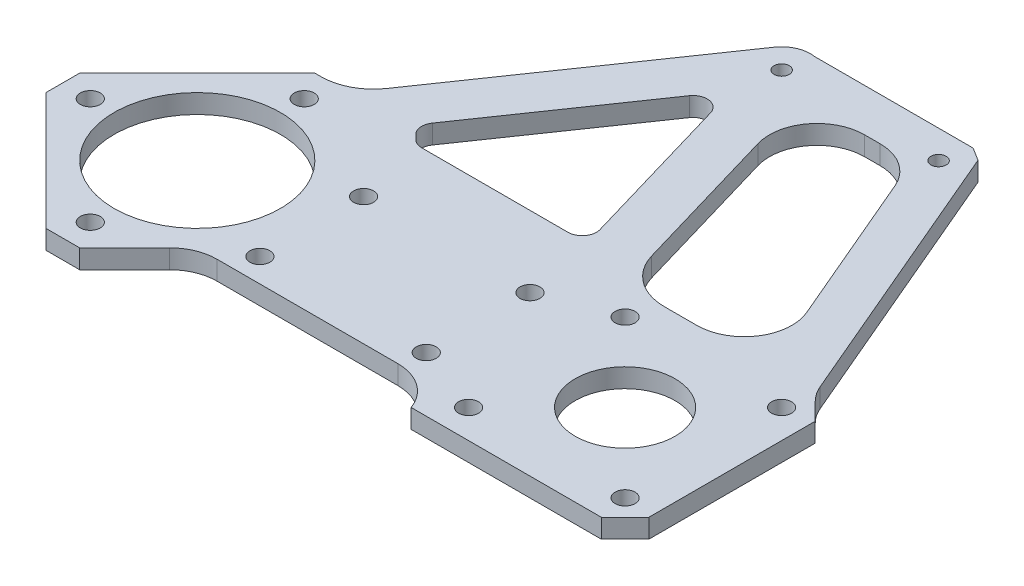
from build123d import *

# Parameters (mm, degrees)
SKETCH_1_R          = 2.1
SKETCH_1_R_2        = 10.5
SKETCH_1_R_3        = 10
EXTRUDE_1_DEPTH     = 4
CHAMFER_1_SIZE      = 5
FILLET_1_R          = 10
SKETCH_2_R          = 2.1
CUT_EXTRUDE_1_DEPTH = 10
EXTRUDE_START       = -4
SKETCH_3_R          = 1.6
EXTRUDE_2_DEPTH     = 4
FILLET_2_R          = 3
FILLET_3_R          = 11
SKETCH_4_R          = 1.6
EXTRUDE_3_DEPTH     = 4
FILLET_4_R          = 10
CHAMFER_2_SIZE      = 2
CHAMFER_2_SIZE2     = 1.851556395
FILLET_5_R          = 10
SKETCH_5_R          = 17.5
CUT_EXTRUDE_2_DEPTH = 10


with BuildPart() as part:
    # 草图1 → 凸台-拉伸1 (new body)
    with BuildSketch(Plane(origin=(0, 0, 0), x_dir=(1, 0, 0), z_dir=(0, 1, 0))):
        Polygon((0, 31.819805153), (-31.819805153, 0), (0, -31.819805153), (15.909902577, -15.909902577), (67.5, -15.909902577), (67.5, -22.5), (112.5, -22.5), (112.5, 22.5), (67.5, 22.5), (67.5, 15.909902577), (15.909902577, 15.909902577), align=None)
        with Locations(Location((0, 14, 0), (0, 0, 270))):
            Circle(SKETCH_1_R, mode=Mode.SUBTRACT)
        with Locations(Location((14, 0, 0), (0, 0, 270))):
            Circle(SKETCH_1_R, mode=Mode.SUBTRACT)
        with Locations(Location((0, -14, 0), (0, 0, 270))):
            Circle(SKETCH_1_R, mode=Mode.SUBTRACT)
        with Locations(Location((-14, 0, 0), (0, 0, 270))):
            Circle(SKETCH_1_R, mode=Mode.SUBTRACT)
        with Locations(Location((90, 0, 0), (0, 0, 270))):
            Circle(SKETCH_1_R_2, mode=Mode.SUBTRACT)
        with Locations(Location((0, 22.5, 0), (0, 0, 270))):
            Circle(SKETCH_1_R, mode=Mode.SUBTRACT)
        with Locations(Location((0, -22.5, 0), (0, 0, 270))):
            Circle(SKETCH_1_R, mode=Mode.SUBTRACT)
        with Locations(Location((0, 0, 0), (0, 0, 270))):
            Circle(SKETCH_1_R_3, mode=Mode.SUBTRACT)
        with Locations(Location((-22.5, 0, 0), (0, 0, 270))):
            Circle(SKETCH_1_R, mode=Mode.SUBTRACT)
    extrude(amount=EXTRUDE_1_DEPTH)

    # 倒角1
    chamfer_1_edges = [part.edges().sort_by_distance(p)[0] for p in [
        (112.5, 2, -22.5),
        (112.5, 2, 22.5),
        (0, 2, 31.819805153),
        (-31.819805153, 2, 0),
        (0, 2, -31.819805153),
    ]]
    chamfer(chamfer_1_edges, length=CHAMFER_1_SIZE)

    # 圆角1
    # the kernel refuses this fillet: 10 mm, written as the material it adds along each edge
    with BuildSketch(Plane(origin=(15.909902577, 0, -15.909902577), x_dir=(-0.707106781186552, 0, -0.707106781186543), z_dir=(0, 1, 0))) as fillet_1_piece_1:
        with BuildLine():
            CenterArc((FILLET_1_R * 0.414213562373, -FILLET_1_R), FILLET_1_R, 90, 45)
            Line((-FILLET_1_R * 0.292893218813, -FILLET_1_R * 0.292893218813), (-FILLET_1_R * 0.307035354437, -FILLET_1_R * 0.27875108319))
            Line((-FILLET_1_R * 0.307035354437, -FILLET_1_R * 0.27875108319), (-FILLET_1_R * 0.00828427124746, FILLET_1_R * 0.02))
            Line((-FILLET_1_R * 0.00828427124746, FILLET_1_R * 0.02), (FILLET_1_R * 0.414213562373, FILLET_1_R * 0.02))
            Line((FILLET_1_R * 0.414213562373, FILLET_1_R * 0.02), (FILLET_1_R * 0.414213562373, 0))
        make_face()
    extrude(amount=4)
    with BuildSketch(Plane(origin=(15.909902577, 0, 15.909902577), x_dir=(-0.7071067811865422, 0, 0.707106781186553), z_dir=(0, 1, 0))) as fillet_1_piece_2:
        with BuildLine():
            CenterArc((FILLET_1_R * 0.414213562373, FILLET_1_R), FILLET_1_R, 225, 45)
            Line((-FILLET_1_R * 0.292893218813, FILLET_1_R * 0.292893218813), (-FILLET_1_R * 0.307035354437, FILLET_1_R * 0.27875108319))
            Line((-FILLET_1_R * 0.307035354437, FILLET_1_R * 0.27875108319), (-FILLET_1_R * 0.00828427124746, -FILLET_1_R * 0.02))
            Line((-FILLET_1_R * 0.00828427124746, -FILLET_1_R * 0.02), (FILLET_1_R * 0.414213562373, -FILLET_1_R * 0.02))
            Line((FILLET_1_R * 0.414213562373, -FILLET_1_R * 0.02), (FILLET_1_R * 0.414213562373, 0))
        make_face()
    extrude(amount=4)
    with BuildSketch(Plane(origin=(67.5, 0, 15.909902577), x_dir=(-1, 0, 0), z_dir=(0, 1, 0))) as fillet_1_piece_3:
        with BuildLine():
            CenterArc((9.400668296, 10), FILLET_1_R, 199.937217397, 70.062782603)
            Line((0, 6.590097423), (-0.188013366, 6.521899372))
            ThreePointArc((-0.188013366, 6.521899372), (-0.2, 3.295048712), (-0.2, 0))
            Line((-0.2, 0), (0, -0.2))
            Line((0, -0.2), (9.400668296, -0.2))
            Line((9.400668296, -0.2), (9.400668296, 0))
        make_face()
    extrude(amount=4)
    with BuildSketch(Plane(origin=(67.5, 0, -15.909902577), x_dir=(-1, 0, 0), z_dir=(0, 1, 0))) as fillet_1_piece_4:
        with BuildLine():
            CenterArc((9.400668296, -10), FILLET_1_R, 90, 70.062782603)
            Line((0, -6.590097423), (-0.188013366, -6.521899372))
            ThreePointArc((-0.188013366, -6.521899372), (-0.2, -3.295048712), (-0.2, 0))
            Line((-0.2, 0), (0, 0.2))
            Line((0, 0.2), (9.400668296, 0.2))
            Line((9.400668296, 0.2), (9.400668296, 0))
        make_face()
    extrude(amount=4)

    # 草图2 → 切除-拉伸1 (cut)
    with BuildSketch(Plane.XZ):
        with Locations(Location((106.464466094, 16.464466094, 0), (0, 0, 270))):
            Circle(SKETCH_2_R)
        with Locations(Location((106.464466094, -16.464466094, 0), (0, 0, 270))):
            Circle(SKETCH_2_R)
        with Locations(Location((73.535533906, -16.464466094, 0), (0, 0, 90))):
            Circle(SKETCH_2_R)
        with Locations(Location((73.535533906, 16.464466094, 0), (0, 0, 90))):
            Circle(SKETCH_2_R)
        with Locations(Location((24.075684952, 10.909902577, 0), (0, 0, 270))):
            Circle(SKETCH_2_R)
        with Locations(Location((59.075684952, 10.909902577, 0), (0, 0, 270))):
            Circle(SKETCH_2_R)
        with Locations(Location((59.075684952, -10.909902577, 0), (0, 0, 90))):
            Circle(SKETCH_2_R)
        with Locations(Location((24.075684952, -10.909902577, 0), (0, 0, 90))):
            Circle(SKETCH_2_R)
    extrude(amount=-CUT_EXTRUDE_1_DEPTH, mode=Mode.SUBTRACT)

    # 草图3 → 凸台-拉伸2 (add)
    with BuildSketch(Plane(origin=(0, 4, 0), x_dir=(1, 0, 0), z_dir=(0, 1, 0)).offset(EXTRUDE_START)):
        with BuildLine():
            Line((3.535533906, 28.284271247), (40.057636417, 81.344203773))
            ThreePointArc((40.057636417, 81.344203773), (45.94930127, 83.86671265), (50.75784592, 79.629654221))
            Line((50.75784592, 79.629654221), (67.5, 22.5))
            ThreePointArc((67.5, 22.5), (63.839583189, 17.721525883), (58.099331704, 15.909902577))
            Line((58.099331704, 15.909902577), (20.0520382, 15.909902577))
            ThreePointArc((20.0520382, 15.909902577), (16.225203877, 16.671107252), (12.980970389, 18.838834765))
            Line((12.980970389, 18.838834765), (3.535533906, 28.284271247))
        make_face()
        with Locations(Location((45, 77.942286341, 0), (0, 0, 270))):
            Circle(SKETCH_3_R, mode=Mode.SUBTRACT)
        Polygon((16.491758356, 29.470182421), (43.526560522, 68.746803428), (56.080145943, 25.909902577), (20.0520382, 25.909902577), align=None, mode=Mode.SUBTRACT)
    extrude(amount=EXTRUDE_2_DEPTH)

    # 圆角2
    fillet_2_edges = [part.edges().sort_by_distance(p)[0] for p in [
        (16.491758356, 2, -29.470182421),
        (43.526560522, 2, -68.746803428),
        (56.080145943, 2, -25.909902577),
        (20.0520382, 2, -25.909902577),
    ]]
    fillet(fillet_2_edges, radius=FILLET_2_R)

    # 圆角3
    fillet_3_edges = [part.edges().sort_by_distance(p)[0] for p in [
        (67.5, 2, -22.5),
        (3.535533906, 2, -28.284271247),
    ]]
    fillet(fillet_3_edges, radius=FILLET_3_R)

    # 草图4 → 凸台-拉伸3 (add)
    with BuildSketch(Plane(origin=(0, 4, 0), x_dir=(1, 0, 0), z_dir=(0, 1, 0)).offset(EXTRUDE_START)):
        with BuildLine():
            Line((45.94930127, 83.86671265), (81.347717681, 83.86671265))
            Line((81.347717681, 83.86671265), (107.5, 22.5))
            Line((107.5, 22.5), (97.716806526, 22.5))
            Line((97.716806526, 22.5), (75.4, 74.86671265))
            Line((75.4, 74.86671265), (52.153651701, 74.86671265))
            Line((52.153651701, 74.86671265), (50.75784592, 79.629654221))
            ThreePointArc((50.75784592, 79.629654221), (48.966689034, 82.443994695), (45.94930127, 83.86671265))
        make_face()
        with Locations(Location((78, 77.942286341, 0), (0, 0, 270))):
            Circle(SKETCH_4_R, mode=Mode.SUBTRACT)
    extrude(amount=EXTRUDE_3_DEPTH)

    # 圆角4
    fillet_4_edges = [part.edges().sort_by_distance(p)[0] for p in [
        (97.716806526, 2, -22.5),
        (75.4, 2, -74.86671265),
        (52.153651701, 2, -74.86671265),
    ]]
    fillet(fillet_4_edges, radius=FILLET_4_R)

    # 倒角2
    chamfer_2_edges = [part.edges().sort_by_distance(p)[0] for p in [
        (81.347717681, 2, -83.86671265),
    ]]
    chamfer_2_side = [part.faces().sort_by_distance(p)[0] for p in [
        (63.648509476, 2, -83.86671265),
    ]]
    chamfer(chamfer_2_edges, length=CHAMFER_2_SIZE, length2=CHAMFER_2_SIZE2, reference=chamfer_2_side[0])

    # 圆角5
    fillet_5_edges = [part.edges().sort_by_distance(p)[0] for p in [
        (107.5, 2, -22.5),
    ]]
    fillet(fillet_5_edges, radius=FILLET_5_R)

    # 草图5 → 切除-拉伸2 (cut)
    with BuildSketch(Plane(origin=(0, 4, 0), x_dir=(1, 0, 0), z_dir=(0, 1, 0))):
        with Locations(Location((0, 0, 0), (0, 0, 270))):
            Circle(SKETCH_5_R)
    extrude(amount=-CUT_EXTRUDE_2_DEPTH, mode=Mode.SUBTRACT)


solid = part.part
